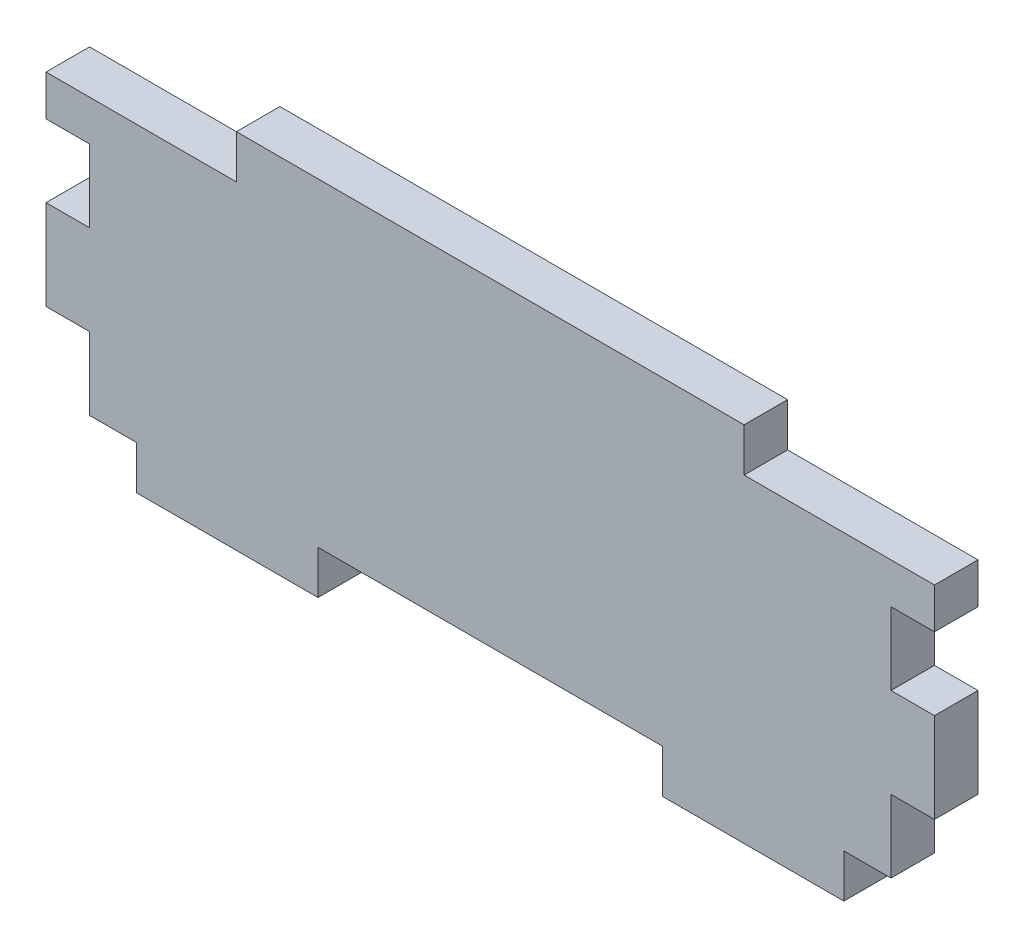
from build123d import *

# Parameters (mm, degrees)
BOSS_EXTRUDE1_DEPTH = 3.048


with BuildPart() as part:
    # Sketch1 → Boss-Extrude1 (new body)
    with BuildSketch(Plane.XY):
        Polygon((3.048, 9.8044), (0, 9.8044), (0, 4.7244), (-3.302, 4.7244), (-3.302, 1.6764), (-16.002, 1.6764), (-16.002, 4.7244), (-40.132, 4.7244), (-40.132, 1.6764), (-52.832, 1.6764), (-52.832, 4.7244), (-56.134, 4.7244), (-56.134, 9.8044), (-59.182, 9.8044), (-59.182, 16.1036), (-56.134, 16.1036), (-56.134, 21.1836), (-59.182, 21.1836), (-59.182, 24.0284), (-45.847, 24.0284), (-45.847, 27.0764), (-10.287, 27.0764), (-10.287, 24.0284), (3.048, 24.0284), (3.048, 21.1836), (0, 21.1836), (0, 16.1036), (3.048, 16.1036), align=None)
    extrude(amount=BOSS_EXTRUDE1_DEPTH)


solid = part.part
